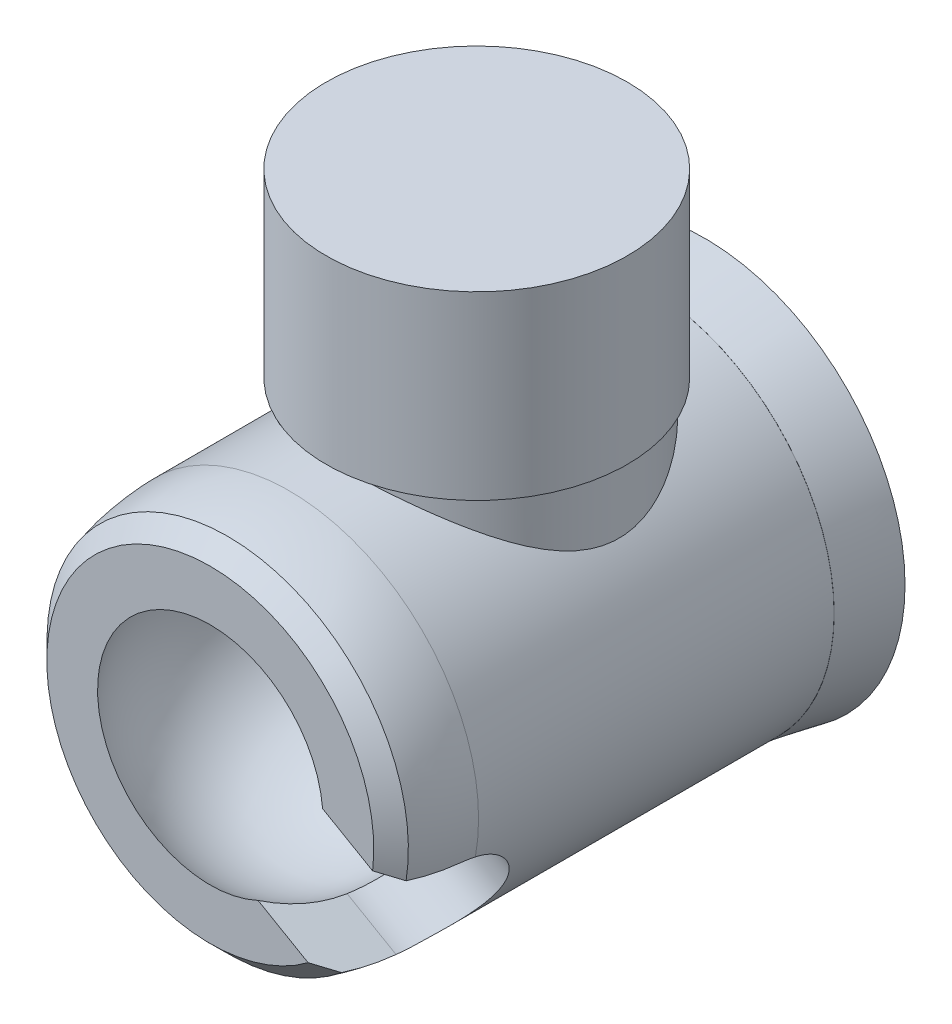
from build123d import *
from OCP.BRepAlgoAPI import BRepAlgoAPI_Cut
from OCP.TopTools import TopTools_ListOfShape

# Parameters (mm, degrees)
SKETCH_1_R          = 23.25
EXTRUDE_1_DEPTH     = 7
EXTRUDE_1_TAPER     = 10
SKETCH_2_R          = 22
EXTRUDE_2_DEPTH     = 50.5
SKETCH_4_R          = 16.5
EXTRUDE_3_DEPTH     = 22.5
SKETCH_6_R          = 17.5
EXTRUDE_4_DEPTH     = 21
CUT_EXTRUDE_START   = -5.710511326
CUT_EXTRUDE_1_DEPTH = 12.710511326
SKETCH_10_R         = 4.8
EXTRUDE_5_DEPTH     = 12
EXTRUDE_6_DEPTH     = 11


with BuildPart() as part:
    # 草图1 → 凸台-拉伸1 (new body)
    with BuildSketch(Plane.XY):
        Circle(SKETCH_1_R)
    extrude(amount=EXTRUDE_1_DEPTH, taper=EXTRUDE_1_TAPER)

    # 草图2 → 凸台-拉伸2 (add)
    with BuildSketch(Plane.XY.offset(7)):
        Circle(SKETCH_2_R)
    extrude(amount=EXTRUDE_2_DEPTH)

    # 草图3 → 切除-旋转1 (revolve, cut)
    with BuildSketch(Plane(origin=(0, 0, 0), x_dir=(1, 0, 0), z_dir=(0, 1, 0))):
        with BuildLine():
            Line((21, -55.477297211), (22, -55.477297211))
            Line((22, -55.477297211), (22, -48.317565939))
            add(Edge.make_bspline(
                [(21, -55.477297211), (21.635397746, -53.150423877), (21.950433845, -50.732091094), (22, -48.317565939)],
                knots=[0, 0, 0, 0, 0.840917251, 0.840917251, 0.840917251, 0.840917251], degree=3))
        make_face()
        Polygon((19, -57.5), (22, -57.5), (22, -55.477297211), (21, -55.477297211), align=None)
    revolve(axis=Axis((0, 0, 57.5), (0, 0, -1)), mode=Mode.SUBTRACT)

    # 草图4 → 凸台-拉伸3 (add)
    with BuildSketch(Plane(origin=(0, 0, 0), x_dir=(1, 0, 0), z_dir=(0, 1, 0))):
        with Locations(Location((0, -26.5, 0), (0, 0, 90))):
            Circle(SKETCH_4_R)
    extrude(amount=EXTRUDE_3_DEPTH)

    # 草图6 → 凸台-拉伸4 (add)
    with BuildSketch(Plane(origin=(0, 22.5, 0), x_dir=(1, 0, 0), z_dir=(0, 1, 0))):
        with Locations(Location((0, -26.526637771, 0), (0, 0, 90))):
            Circle(SKETCH_6_R)
    extrude(amount=EXTRUDE_4_DEPTH)

    # 草图7 → 切除-旋转2 (revolve, cut)
    with BuildSketch(Plane(origin=(0, 0, 0), x_dir=(0, 0, -1), z_dir=(1, 0, 0))):
        with BuildLine():
            Line((-64.317565939, 0), (-32.317565939, 0))
            ThreePointArc((-32.317565939, 0), (-48.317565939, 16), (-64.317565939, 0))
        make_face()
    revolve(axis=Axis((0, 0, 57.5), (0, 0, -1)), mode=Mode.SUBTRACT)


with BuildPart() as cut_extrude_1_tool:
    # 切除-拉伸1: read off the stored shape, not the designer's step
    # 切除-拉伸1 outline → 切除-拉伸1 (new body)
    with BuildSketch(Plane(origin=(14.249995527, -8.227238754, -1.478e-06), x_dir=(0.49999999999999495, 0.8660254037844416, 0), z_dir=(0.8660254037844382, -0.49999999999999295, -8.981993465039313e-08)).offset(CUT_EXTRUDE_START)):
        with BuildLine():
            ThreePointArc((-7.5, 49.99999845), (3.87e-07, 42.5), (7.5, 49.999999225))
            Line((7.5, 49.999999225), (7.5, 57.5))
            Line((7.5, 57.5), (-7.5, 57.499999177))
            Line((-7.5, 57.499999177), (-7.5, 49.99999845))
        make_face()
    extrude(amount=CUT_EXTRUDE_1_DEPTH)


with BuildPart() as part_1:
    add(part.part)

    # 切除-拉伸1: cut by cut_extrude_1_tool, with a tolerance
    cut_extrude_1_stock = TopTools_ListOfShape()
    cut_extrude_1_stock.Append(part_1.part.wrapped)
    cut_extrude_1_tools = TopTools_ListOfShape()
    cut_extrude_1_tools.Append(cut_extrude_1_tool.part.wrapped)
    cut_extrude_1_cut = BRepAlgoAPI_Cut()
    cut_extrude_1_cut.SetArguments(cut_extrude_1_stock)
    cut_extrude_1_cut.SetTools(cut_extrude_1_tools)
    cut_extrude_1_cut.SetFuzzyValue(0.00001)
    cut_extrude_1_cut.Build()
    add(Compound.cast(cut_extrude_1_cut.Shape()).solids(), mode=Mode.REPLACE)

    # 草图10 → 凸台-拉伸5 (add)
    with BuildSketch(Plane(origin=(-14.25, -8.227241336, 0), x_dir=(0.500000000000007, -0.8660254037844346, 0), z_dir=(0.8660254037844346, 0.500000000000007, 0))):
        with Locations(Location((0, -13.6, 0), (0, 0, 180))):
            Circle(SKETCH_10_R)
    extrude(amount=-EXTRUDE_5_DEPTH)

    # 草图11 → 凸台-拉伸6 (add)
    with BuildSketch(Plane(origin=(-24.642304845, -14.227241336, 0), x_dir=(0, 0, 1), z_dir=(-0.8660254037844347, -0.500000000000007, 0))):
        with BuildLine():
            ThreePointArc((19.6, 0), (19.453472666, 1.31789899), (19.021047417, 2.571428571))
            ThreePointArc((19.021047417, 2.571428571), (16.807134903, 5.070925528), (13.6, 6))
            Line((13.6, 6), (13.6, 4.8))
            ThreePointArc((13.6, 4.8), (16.99411255, 3.39411255), (18.4, 0))
            ThreePointArc((18.4, 0), (16.99411255, -3.39411255), (13.6, -4.8))
            Line((13.6, -4.8), (13.6, -6))
            ThreePointArc((13.6, -6), (17.842640687, -4.242640687), (19.6, 0))
        make_face()
        with BuildLine():
            Line((13.6, 4.8), (13.6, 6))
            ThreePointArc((13.6, 6), (10.392865097, 5.070925528), (8.178952583, 2.571428571))
            ThreePointArc((8.178952583, 2.571428571), (8.529074472, -3.207134903), (13.6, -6))
            Line((13.6, -6), (13.6, -4.8))
            ThreePointArc((13.6, -4.8), (8.8, 0), (13.6, 4.8))
        make_face()
        with BuildLine():
            Line((19.021047417, 2.571428571), (15.407015806, 10.19047619))
            ThreePointArc((15.407015806, 10.19047619), (14.669044968, 11.023641843), (13.6, 11.333333333))
            Line((13.6, 11.333333333), (13.6, 6))
            ThreePointArc((13.6, 6), (16.807134903, 5.070925528), (19.021047417, 2.571428571))
        make_face()
        with BuildLine():
            Line((13.6, 6), (13.6, 11.333333333))
            ThreePointArc((13.6, 11.333333333), (12.530955032, 11.023641843), (11.792984194, 10.19047619))
            Line((11.792984194, 10.19047619), (8.178952583, 2.571428571))
            ThreePointArc((8.178952583, 2.571428571), (10.392865097, 5.070925528), (13.6, 6))
        make_face()
        with BuildLine():
            ThreePointArc((18.4, 0), (16.99411255, 3.39411255), (13.6, 4.8))
            Line((13.6, 4.8), (13.6, -4.8))
            ThreePointArc((13.6, -4.8), (16.99411255, -3.39411255), (18.4, 0))
        make_face()
        with BuildLine():
            Line((13.6, -4.8), (13.6, 4.8))
            ThreePointArc((13.6, 4.8), (8.8, 0), (13.6, -4.8))
        make_face()
    extrude(amount=EXTRUDE_6_DEPTH)


solid = part_1.part
